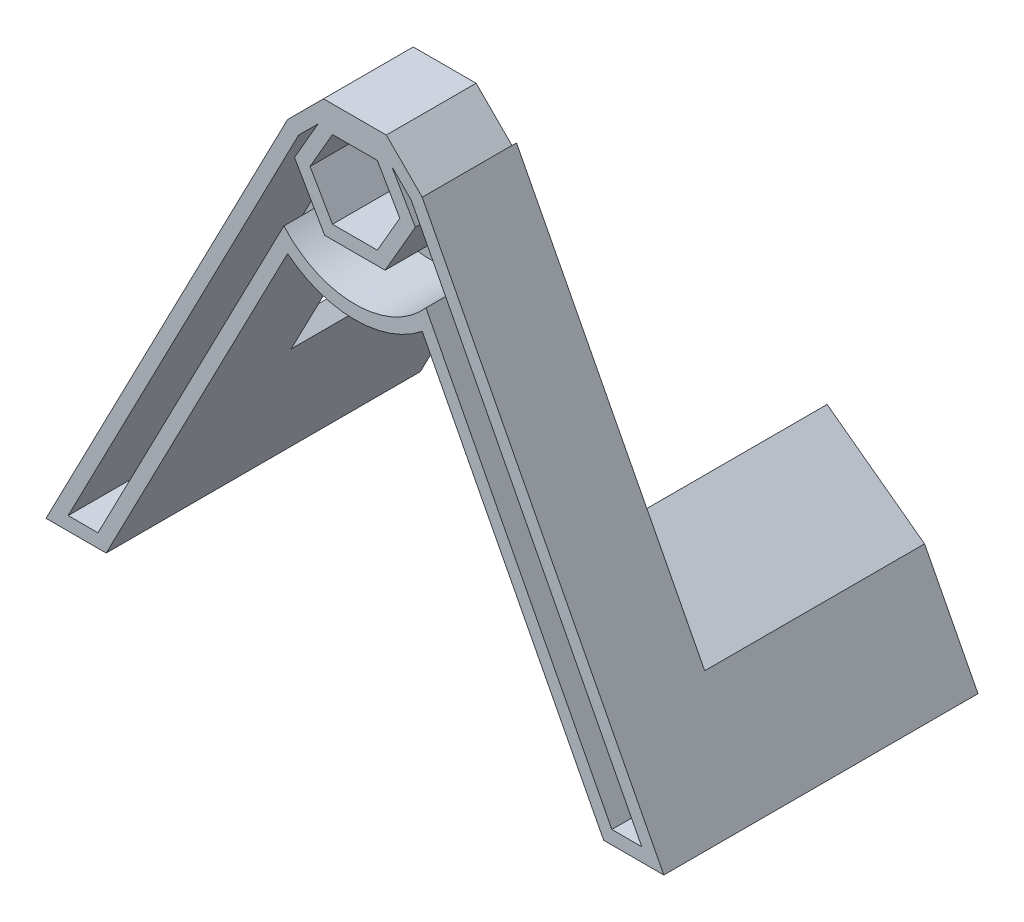
from build123d import *

# Parameters (mm, degrees)
SKETCH1_W                = 30
SKETCH1_H                = 110
BOSS_EXTRUDE1_DEPTH      = 20
CUT_EXTRUDE1_DEPTH       = 60
CHAMFER1_SIZE            = 8
BOSS_EXTRUDE2_DEPTH      = 21
BOSS_EXTRUDE3_DEPTH      = 50
BOSS_EXTRUDE3_DEPTH_BACK = 18
CUT_EXTRUDE3_DEPTH       = 260
SHELL1_START             = 3
SHELL1_DEPTH             = 17
SHELL1_START_2           = -47
SHELL1_2_DEPTH           = 50
SHELL1_START_3           = 2
SHELL1_3_DEPTH           = 1


# Read off the part's stored shape, not the designer's step: Shell1
with BuildPart() as part:
    # Sketch1 → Boss-Extrude1 (new body)
    with BuildSketch(Plane.XY):
        with Locations((15, 55)):
            Rectangle(SKETCH1_W, SKETCH1_H)
    extrude(amount=BOSS_EXTRUDE1_DEPTH)

    # Sketch2 → Cut-Extrude1 (cut)
    with BuildSketch(Plane.XY.offset(20)):
        Polygon((25, 95.443111243), (20, 104.103365281), (10, 104.103365281), (5, 95.443111243), (10, 86.782857205), (20, 86.782857205), align=None)
    extrude(amount=-CUT_EXTRUDE1_DEPTH, mode=Mode.SUBTRACT)

    # Chamfer1
    chamfer1_edges = [part.edges().sort_by_distance(p)[0] for p in [
        (0, 110, 10),
        (30, 110, 10),
    ]]
    chamfer(chamfer1_edges, length=CHAMFER1_SIZE)

    # Sketch3 → Boss-Extrude2 (add)
    with BuildSketch(Plane.XY.offset(20)):
        Polygon((-40.427156972, -1.878677735), (-53.835121548, -1.878677735), (0, 102), (0, 76.128383271), align=None)
        Polygon((30, 102), (83.835121548, -1.878677735), (70.427156972, -1.878677735), (30, 76.128383271), align=None)
    extrude(amount=-BOSS_EXTRUDE2_DEPTH)

    # Sketch5 → Boss-Extrude3 (add, two sides: drawn at the far end of the back side and taken through both)
    with BuildSketch(Plane(origin=(0, 0, 0), x_dir=(-1, 0, 0), z_dir=(0, 0, -1)).offset(-BOSS_EXTRUDE3_DEPTH_BACK)):
        Polygon((-83.835121548, -1.878677735), (-71.933606609, 21.086137785), (-50.213578486, 37.124852768), (-70.427156972, -1.878677735), align=None)
        Polygon((40.427156972, -1.878677735), (53.835121548, -1.878677735), (41.933606609, 21.086137785), (20.213578486, 37.124852768), align=None)
    extrude(amount=BOSS_EXTRUDE3_DEPTH + BOSS_EXTRUDE3_DEPTH_BACK)

    # Sketch8 → Cut-Extrude3 (cut)
    with BuildSketch(Plane.XY.offset(20)):
        with BuildLine():
            Line((0, 76.128383271), (0, -18.897317389))
            Line((0, -18.897317389), (30, -18.897317389))
            Line((30, -18.897317389), (30, 76.128383271))
            ThreePointArc((30, 76.128383271), (15, 70.851219372), (0, 76.128383271))
        make_face()
    extrude(amount=-CUT_EXTRUDE3_DEPTH, mode=Mode.SUBTRACT)

    # Shell1 outline → Shell1 (cut)
    with BuildSketch(Plane.XY.offset(SHELL1_START)):
        with BuildLine():
            Line((28.464101615, 95.443111243), (21.732050808, 83.782857205))
            Line((21.732050808, 83.782857205), (8.267949192, 83.782857205))
            Line((8.267949192, 83.782857205), (1.535898385, 95.443111243))
            Line((1.535898385, 95.443111243), (6.795296251, 104.552655563))
            Line((6.795296251, 104.552655563), (2.449804376, 100.207163689))
            Line((2.449804376, 100.207163689), (-48.901429901, 1.121322265))
            Line((-48.901429901, 1.121322265), (-42.251348803, 1.121322265))
            Line((-42.251348803, 1.121322265), (-0.820872426, 81.064359083))
            ThreePointArc((-0.820872426, 81.064359083), (15, 73.851219372), (30.820872426, 81.064359083))
            Line((30.820872426, 81.064359083), (72.251348803, 1.121322265))
            Line((72.251348803, 1.121322265), (78.901429901, 1.121322265))
            Line((78.901429901, 1.121322265), (27.550195624, 100.207163689))
            Line((27.550195624, 100.207163689), (23.204703749, 104.552655563))
            Line((23.204703749, 104.552655563), (28.464101615, 95.443111243))
        make_face()
    extrude(amount=SHELL1_DEPTH, mode=Mode.SUBTRACT)

    # Shell1 2 outline → Shell1 2 (cut)
    with BuildSketch(Plane.XY.offset(SHELL1_START_2)):
        Polygon((78.901429901, 1.121322265), (69.590785527, 19.086869637), (58.818087877, 27.041750092), (72.251348803, 1.121322265), align=None)
        Polygon((-28.818087877, 27.041750092), (-39.590785527, 19.086869637), (-48.901429901, 1.121322265), (-42.251348803, 1.121322265), align=None)
    extrude(amount=SHELL1_2_DEPTH, mode=Mode.SUBTRACT)

    # Shell1 3 outline → Shell1 3 (cut)
    with BuildSketch(Plane.XY.offset(SHELL1_START_3)):
        Polygon((69.590785527, 19.086869637), (33, 89.691380382), (33, 76.85957818), (58.818087877, 27.041750092), align=None)
        Polygon((-3, 76.85957818), (-3, 89.691380382), (-39.590785527, 19.086869637), (-28.818087877, 27.041750092), align=None)
    extrude(amount=SHELL1_3_DEPTH, mode=Mode.SUBTRACT)


solid = part.part
